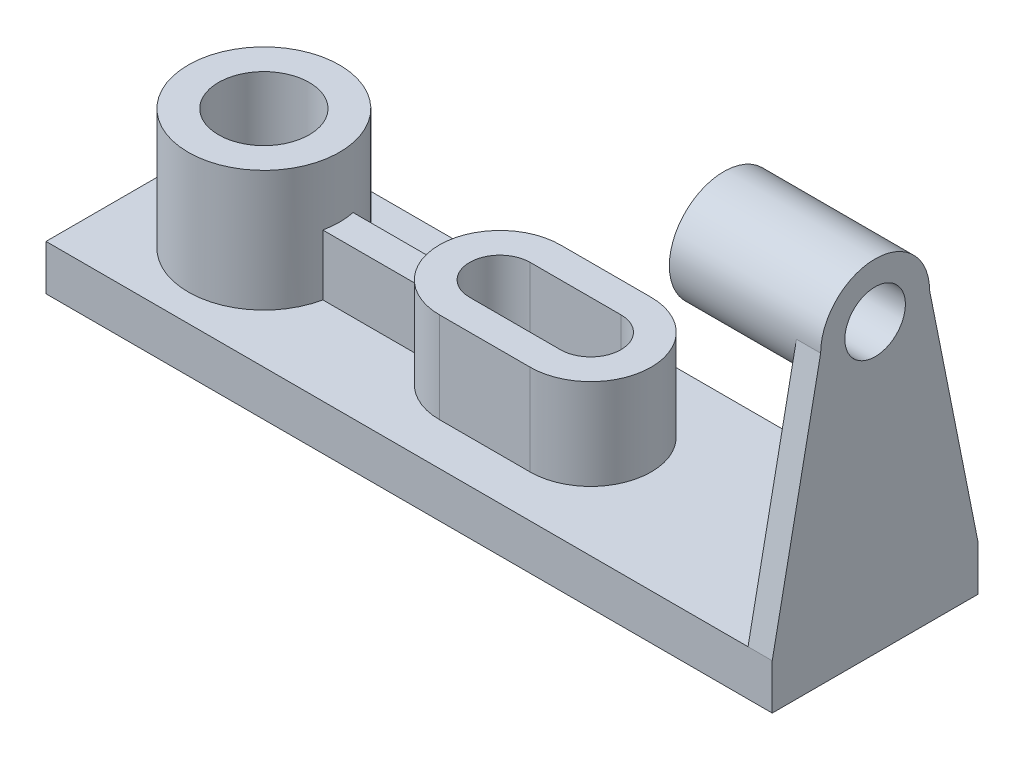
from build123d import *
from build123d.topology import SkipClean

# Parameters (mm, degrees)
SKETCH2_W           = 240
SKETCH2_H           = 68
BOSS_EXTRUDE1_DEPTH = 15
SKETCH4_R           = 25
SKETCH4_R_2         = 15
BOSS_EXTRUDE4_DEPTH = 40
CUT_EXTRUDE2_START  = -40
SKETCH7_R           = 15
CUT_EXTRUDE2_DEPTH  = 40
BOSS_EXTRUDE5_DEPTH = 30
CUT_EXTRUDE3_DEPTH  = 77
RIB3_REACH          = 138.312
SKETCH11_WALL_W     = 307.624283584
SKETCH11_WALL_H     = 10
BOSS_EXTRUDE6_DEPTH = 8
SKETCH13_R          = 18
BOSS_EXTRUDE7_DEPTH = 42
SKETCH14_R          = 10
CUT_EXTRUDE4_DEPTH  = 67


with BuildPart() as part:
    # Sketch2 → Boss-Extrude1 (new body)
    with BuildSketch(Plane(origin=(0, 0, 0), x_dir=(1, 0, 0), z_dir=(0, 1, 0))):
        Rectangle(SKETCH2_W, SKETCH2_H)
    extrude(amount=BOSS_EXTRUDE1_DEPTH)

    # Sketch4 → Boss-Extrude4 (add)
    with BuildSketch(Plane(origin=(0, 15, 0), x_dir=(1, 0, 0), z_dir=(0, 1, 0))):
        with Locations((-82, 0)):
            Circle(SKETCH4_R)
        with Locations((-82, 0)):
            Circle(SKETCH4_R_2, mode=Mode.SUBTRACT)
    extrude(amount=BOSS_EXTRUDE4_DEPTH)

    # Sketch7 → Cut-Extrude2 (cut)
    with BuildSketch(Plane(origin=(0, 15, 0), x_dir=(1, 0, 0), z_dir=(0, 1, 0)).offset(CUT_EXTRUDE2_START)):
        with Locations((-82, 0)):
            Circle(SKETCH7_R)
    extrude(amount=CUT_EXTRUDE2_DEPTH, mode=Mode.SUBTRACT)

    # Sketch8 → Boss-Extrude5 (add)
    with BuildSketch(Plane(origin=(0, 15, 0), x_dir=(1, 0, 0), z_dir=(0, 1, 0))):
        with BuildLine():
            Line((-4, 20), (26, 20))
            ThreePointArc((26, 20), (46, 0), (26, -20))
            Line((26, -20), (-4, -20))
            ThreePointArc((-4, -20), (-24, 0), (-4, 20))
        make_face()
    extrude(amount=BOSS_EXTRUDE5_DEPTH)

    # Sketch9 → Cut-Extrude3 (cut)
    with BuildSketch(Plane(origin=(0, 45, 0), x_dir=(1, 0, 0), z_dir=(0, 1, 0))):
        with BuildLine():
            Line((-4, -10), (26, -10))
            ThreePointArc((26, -10), (36, 0), (26, 10))
            Line((26, 10), (-4, 10))
            ThreePointArc((-4, 10), (-14, 0), (-4, -10))
        make_face()
    extrude(amount=-CUT_EXTRUDE3_DEPTH, mode=Mode.SUBTRACT)

    # Sketch11 wall → Rib3 (add, up to next)
    with BuildSketch(Plane(origin=(-40.5, 35, 0), x_dir=(1, 0, 0), z_dir=(0, 1, 0)), mode=Mode.PRIVATE) as rib3_sk1:
        Rectangle(SKETCH11_WALL_W, SKETCH11_WALL_H)
    rib3_tool1 = extrude(rib3_sk1.sketch, amount=-RIB3_REACH, mode=Mode.PRIVATE) - part.part
    add(rib3_tool1.solids().sort_by_distance((-40.5, 35, 0))[0])

    # Sketch12 → Boss-Extrude6 (add)
    with BuildSketch(Plane(origin=(120, 0, 0), x_dir=(0, 0, -1), z_dir=(1, 0, 0))):
        with BuildLine():
            Line((-18, 95), (-34, 15))
            Line((-34, 15), (34, 15))
            Line((34, 15), (18, 95))
            ThreePointArc((18, 95), (0, 113), (-18, 95))
        make_face()
    extrude(amount=-BOSS_EXTRUDE6_DEPTH)

    # Sketch13 → Boss-Extrude7 (add)
    with SkipClean():  # the faces are left unmerged after this step: merging them gives an invalid solid
        with BuildSketch(Plane.ZY.offset(-112)):
            with Locations((0, 95)):
                Circle(SKETCH13_R)
        extrude(amount=BOSS_EXTRUDE7_DEPTH)
    add(part.part.scale(1), mode=Mode.REPLACE)  # the faces are merged on a copy

    # Sketch14 → Cut-Extrude4 (cut)
    with BuildSketch(Plane.ZY.offset(-70)):
        with Locations((0, 95)):
            Circle(SKETCH14_R)
    extrude(amount=-CUT_EXTRUDE4_DEPTH, mode=Mode.SUBTRACT)


solid = part.part
